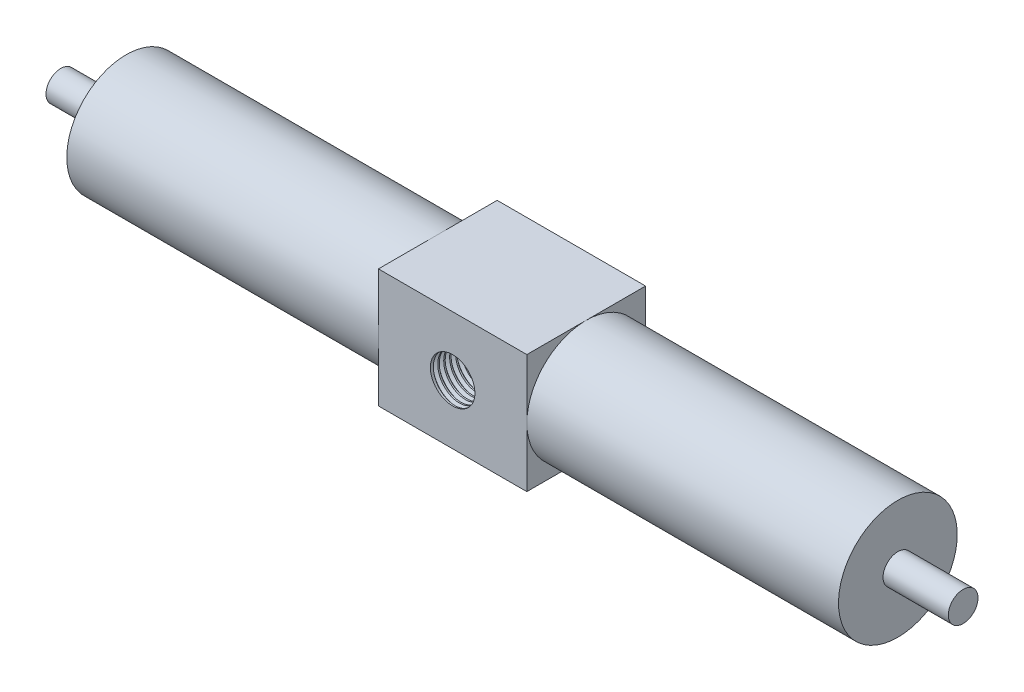
from build123d import *

# Parameters (mm, degrees)
SKETCH4_W           = 50
SKETCH4_H           = 40
BOSS_EXTRUDE2_DEPTH = 20
SKETCH5_R           = 7.500000003
CUT_EXTRUDE2_DEPTH  = 58
THREAD2_PITCH       = 2


with BuildPart() as part:
    # Sketch1 → Revolve2 (revolve)
    with BuildSketch(Plane.XY, mode=Mode.PRIVATE) as revolve2_sk:
        Polygon((-148.332408814, 138.430928626), (-148.332408814, 153.430928626), (111.667591186, 153.430928626), (111.667591186, 138.430928626), (133.667591186, 138.430928626), (133.667591186, 133.430928626), (-170.332408814, 133.430928626), (-170.332408814, 138.430928626), align=None)
    revolve(revolve2_sk.sketch.rotate(Axis((-170.332408814, 133.430928626, 0), (1, 0, 0)), 180), axis=Axis((-170.332408814, 133.430928626, 0), (1, 0, 0)))

    # Sketch4 → Boss-Extrude2 (add, symmetric)
    with BuildSketch(Plane.XY):
        with Locations((-18.332408814, 133.430928626)):
            Rectangle(SKETCH4_W, SKETCH4_H)
    extrude(amount=BOSS_EXTRUDE2_DEPTH, both=True)

    # Sketch5 → Cut-Extrude2 (cut)
    with BuildSketch(Plane.XY.offset(20)):
        with Locations((-18.332408814, 133.430928626)):
            Circle(SKETCH5_R)
    extrude(amount=-CUT_EXTRUDE2_DEPTH, mode=Mode.SUBTRACT)

    # Thread2: arcs per turn and ends read off the stored shape
    # Thread2: the profile of Thread Profile2 profile screwed along a right-hand helix through 20 turns, 10 arcs to a turn; built about Z, then put on its axis
    thread2_z = Axis((0, 0, 0), (0, 0, 1))
    thread2_corners = [(7.499700003, 0, -0.000173205), (8.582531753, 0, 0.624999997), (8.582531753, 0, 0.874999997), (7.499700003, 0, 1.5001732)]
    with BuildLine(mode=Mode.PRIVATE) as thread2_profile:
        Line(thread2_corners[0], thread2_corners[1])
        Line(thread2_corners[1], thread2_corners[2])
        Line(thread2_corners[2], thread2_corners[3])
        Line(thread2_corners[3], thread2_corners[0])
    thread2_cap = Face(thread2_profile.wire())
    thread2_turn_angles = [0, 18, 36, 54, 72, 90, 108, 126, 144, 162, 180, 198, 216, 234, 252, 270, 288, 306, 324, 342, 360]
    thread2_turn_weights = [1, 0.9510565162951535, 1, 0.9510565162951535, 1, 0.9510565162951535, 1, 0.9510565162951535, 1, 0.9510565162951535, 1, 0.9510565162951535, 1, 0.9510565162951535, 1, 0.9510565162951535, 1, 0.9510565162951535, 1, 0.9510565162951535, 1]
    thread2_turn_rails = [Edge.make_bspline([Vector(p[0], p[1], 0).rotate(thread2_z, thread2_turn_angles[k]) / thread2_turn_weights[k] + Vector(0, 0, p[2] + THREAD2_PITCH * thread2_turn_angles[k] / 360) for k in range(21)], [0, 0, 0, 1, 1, 2, 2, 3, 3, 4, 4, 5, 5, 6, 6, 7, 7, 8, 8, 9, 9, 10, 10, 10], 2, thread2_turn_weights) for p in thread2_corners]
    thread2_turn_sides = [Face.make_surface_from_curves(thread2_turn_rails[p[0]], thread2_turn_rails[p[1]]) for p in [(0, 1), (1, 2), (2, 3), (3, 0)]]
    thread2 = Plane(origin=(-18.332408814, 133.430928626, 20), x_dir=(1, 0, 0), z_dir=(0, 0, -1)) * Solid(Shell([*[p.moved(Location((0, 0, THREAD2_PITCH * i))) for i in range(20) for p in thread2_turn_sides], thread2_cap, thread2_cap.rotate(thread2_z, 7200).moved(Location((0, 0, THREAD2_PITCH * 7200 / 360)))]))
    add(thread2, mode=Mode.SUBTRACT)


solid = part.part
